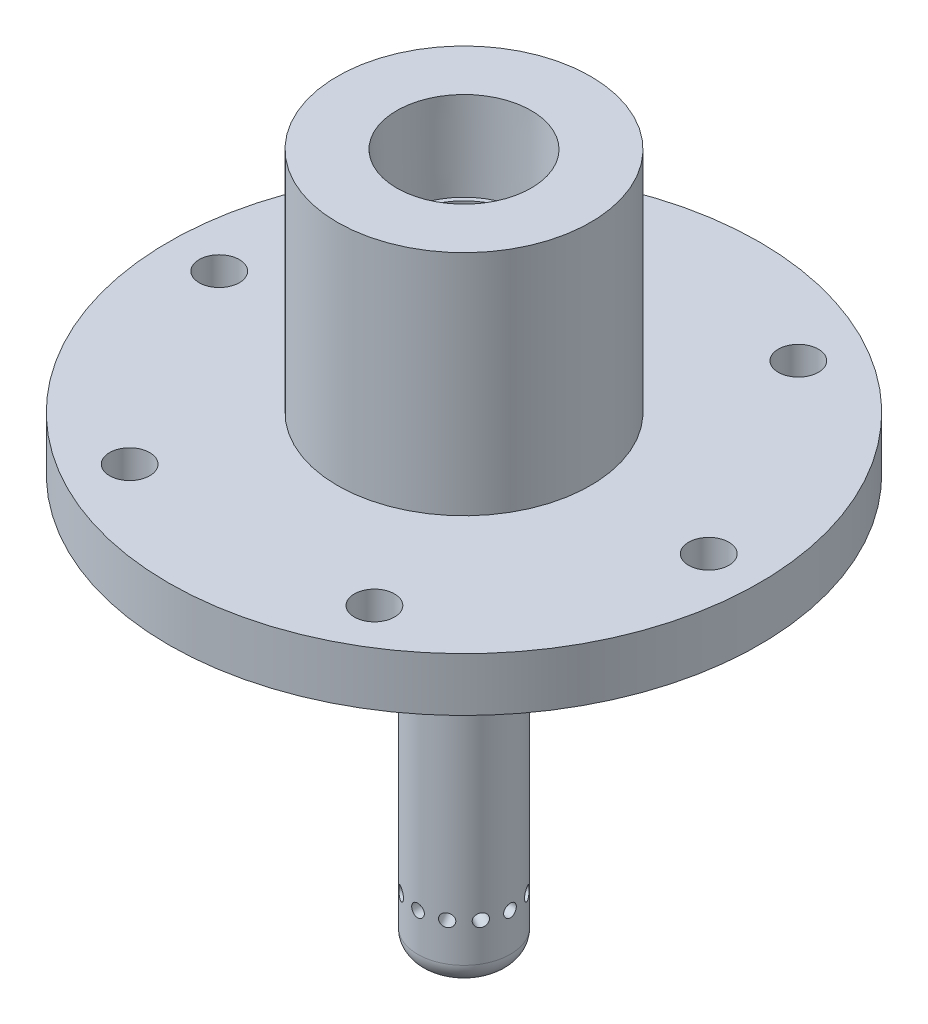
from build123d import *

# Parameters (mm, degrees)
F_6_0_6_DIAMETER_HOLE1_D       = 6
F_6_0_6_DIAMETER_HOLE1_DEPTH   = 78.197418143
F_6_0_6_DIAMETER_HOLE1_TIP     = 1.802581857
SKETCH5_R                      = 24
SKETCH5_R_2                    = 21
CUT_EXTRUDE1_DEPTH             = 3
F_3_16_0_1875_DIAMETER_HOLE1_D = 4.7625
CIRPATTERN1_COUNT              = 6
SKETCH9_R                      = 0.75
CUT_EXTRUDE2_DEPTH             = 10
CIRPATTERN2_COUNT              = 12


with BuildPart() as part:
    # Sketch1 → Revolve1 (revolve)
    with BuildSketch(Plane.XY):
        with BuildLine():
            Line((0, 0), (-15, 0))
            Line((-15, 0), (-15, -27))
            Line((-15, -27), (-35, -27))
            Line((-35, -27), (-35, -33.35))
            Line((-35, -33.35), (-16, -33.35))
            Line((-16, -33.35), (-16, -35.85))
            Line((-16, -35.85), (-10, -35.85))
            Line((-10, -35.85), (-10, -40.85))
            Line((-10, -40.85), (-5.5, -45.35))
            Line((-5.5, -45.35), (-5.5, -79.85))
            ThreePointArc((-5.5, -79.85), (-4.767766953, -81.617766953), (-3, -82.35))
            Line((-3, -82.35), (0, -82.35))
            Line((0, -82.35), (0, 0))
        make_face()
    revolve(axis=Axis((0, -82.35, 0), (0, 1, 0)))

    # Ø6.0 (6) Diameter Hole1
    with Locations(Plane(origin=(0, 0, 0), x_dir=(1, 0, 0), z_dir=(0, 1, 0))):
        with Locations((0, 0)):
            Hole(F_6_0_6_DIAMETER_HOLE1_D / 2, depth=F_6_0_6_DIAMETER_HOLE1_DEPTH)
            with Locations((0, 0, -(F_6_0_6_DIAMETER_HOLE1_DEPTH + F_6_0_6_DIAMETER_HOLE1_TIP / 2))):  # 118° drill point
                Cone(0, F_6_0_6_DIAMETER_HOLE1_D / 2, F_6_0_6_DIAMETER_HOLE1_TIP, mode=Mode.SUBTRACT)

    # Sketch5 → Cut-Extrude1 (cut)
    with BuildSketch(Plane(origin=(0, -33.35, 0), x_dir=(-1, 0, 0), z_dir=(0, -1, 0))):
        Circle(SKETCH5_R)
        Circle(SKETCH5_R_2, mode=Mode.SUBTRACT)
    extrude(amount=-CUT_EXTRUDE1_DEPTH, mode=Mode.SUBTRACT)

    # 3/16 (0.1875) Diameter Hole1 (through all)
    with Locations(Plane(origin=(0, -27, 0), x_dir=(1, 0, 0), z_dir=(0, 1, 0))):
        with Locations((29, 0)):
            f_3_16_0_1875_diameter_hole1 = Hole(F_3_16_0_1875_DIAMETER_HOLE1_D / 2)

    # CirPattern1: 3/16 (0.1875) Diameter Hole1 ×6 about axis
    cirpattern1_axis = Axis((0, -82.35, 0), (0, -1, 0))
    for i in range(1, CIRPATTERN1_COUNT):
        add(f_3_16_0_1875_diameter_hole1.rotate(cirpattern1_axis, i * 360 / CIRPATTERN1_COUNT), mode=Mode.SUBTRACT)

    # Sketch9 → Cut-Extrude2 (cut)
    with BuildSketch(Plane.XY.offset(10)):
        with Locations((0, -75.35)):
            Circle(SKETCH9_R)
    cut_extrude2 = extrude(amount=-CUT_EXTRUDE2_DEPTH, mode=Mode.SUBTRACT)

    # CirPattern2: Cut-Extrude2 ×12 about axis
    cirpattern2_axis = Axis((0, -79.85, 0), (0, -1, 0))
    for i in range(1, CIRPATTERN2_COUNT):
        add(cut_extrude2.rotate(cirpattern2_axis, i * 360 / CIRPATTERN2_COUNT), mode=Mode.SUBTRACT)

    # Sketch11 → 3/8 NPT Tapped Hole1 (revolve, cut)
    with BuildSketch(Plane(origin=(0, 0, 0), x_dir=(0, 0, 1), z_dir=(1, 0, 0))):
        Polygon((0, 0), (0, 17.38), (7.1374, 13.091417418), (7.1374, 10.33), (7.653732966, 10.33), (7.963027, 0), align=None)
    revolve(axis=Axis((0, 6.35, 0), (0, -1, 0)), mode=Mode.SUBTRACT)


solid = part.part
